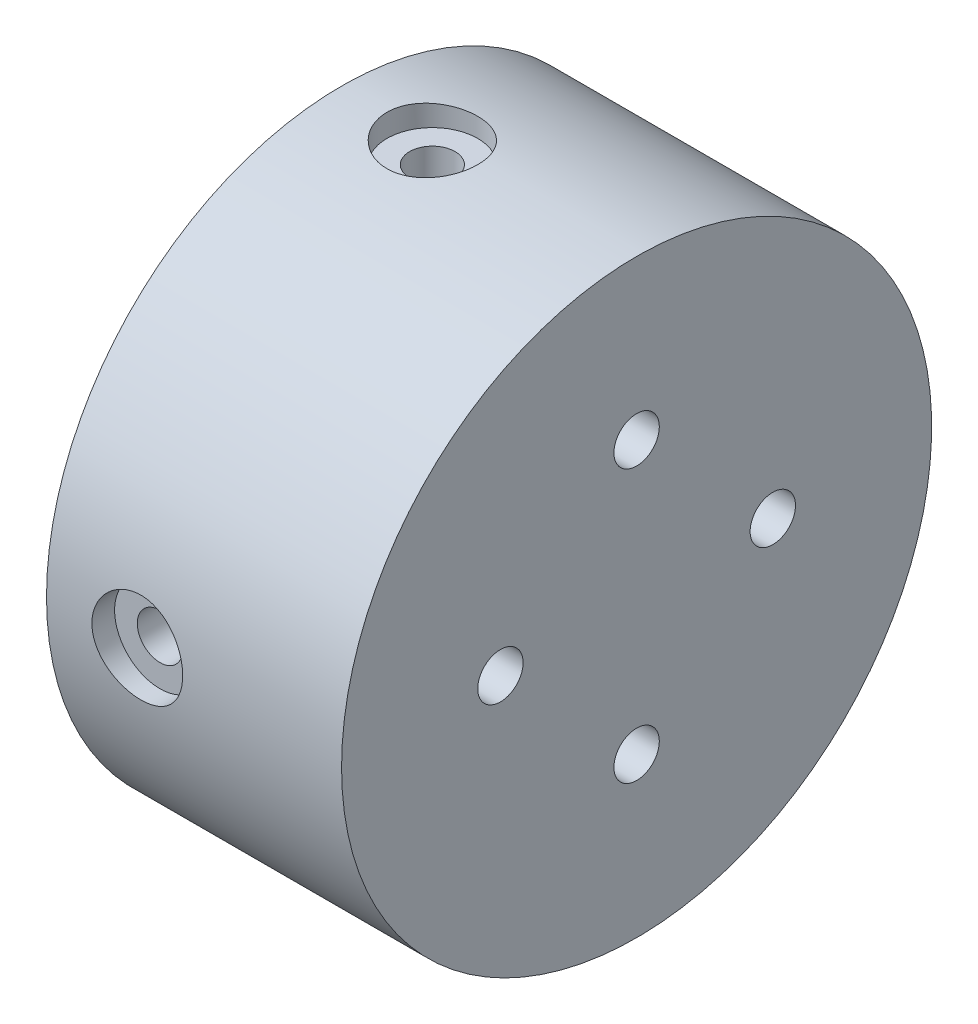
from build123d import *

# Parameters (mm, degrees)
CUT_EXTRUDE_1_REACH      = 24.517
SKETCH_2_R               = 1
PATTERN_CIRCULAR_1_COUNT = 4
SKETCH_5_R               = 1
CUT_EXTRUDE_2_DEPTH      = 10
PATTERN_CIRCULAR_3_COUNT = 4
SKETCH_7_R               = 2
CUT_EXTRUDE_3_DEPTH      = 1
PATTERN_CIRCULAR_4_COUNT = 4


with BuildPart() as part:
    # Эскиз1 → Повернуть1 (revolve)
    with BuildSketch(Plane.XY):
        Polygon((0, 13), (13, 13), (13, 0), (10, 0), (10, 10), (0, 10), align=None)
    revolve(axis=Axis((0, 0, 0), (1, 0, 0)))

    # Эскиз2 → Вырез-Вытянуть1 (cut, up to next)
    with BuildSketch(Plane(origin=(13, 0, 0), x_dir=(0, 0, -1), z_dir=(1, 0, 0)), mode=Mode.PRIVATE) as cut_extrude_1_sk1:
        with Locations((0, 6)):
            Circle(SKETCH_2_R)
    cut_extrude_1_tool1 = extrude(cut_extrude_1_sk1.sketch, amount=-CUT_EXTRUDE_1_REACH, mode=Mode.PRIVATE) & part.part
    cut_extrude_1 = cut_extrude_1_tool1.solids().sort_by_distance((13, 6, 0))[0]
    add(cut_extrude_1, mode=Mode.SUBTRACT)

    # Круговой массив1: Вырез-Вытянуть1 ×4 about axis
    pattern_circular_1_axis = Axis((10, 0, 0), (-1, 0, 0))
    for i in range(1, PATTERN_CIRCULAR_1_COUNT):
        add(cut_extrude_1.rotate(pattern_circular_1_axis, i * 360 / PATTERN_CIRCULAR_1_COUNT), mode=Mode.SUBTRACT)

    # Эскиз5 → Вырез-Вытянуть2 (cut)
    with BuildSketch(Plane.XY.offset(13)):
        with Locations((4, 0)):
            Circle(SKETCH_5_R)
    cut_extrude_2 = extrude(amount=-CUT_EXTRUDE_2_DEPTH, mode=Mode.SUBTRACT)

    # Круговой массив3: Вырез-Вытянуть2 ×4 about axis
    pattern_circular_3_axis = Axis((10, 0, 0), (-1, 0, 0))
    for i in range(1, PATTERN_CIRCULAR_3_COUNT):
        add(cut_extrude_2.rotate(pattern_circular_3_axis, i * 360 / PATTERN_CIRCULAR_3_COUNT), mode=Mode.SUBTRACT)

    # Эскиз7 → Вырез-Вытянуть3 (cut)
    with BuildSketch(Plane.XY.offset(13)):
        with Locations((4, 0)):
            Circle(SKETCH_7_R)
    cut_extrude_3 = extrude(amount=-CUT_EXTRUDE_3_DEPTH, mode=Mode.SUBTRACT)

    # Круговой массив4: Вырез-Вытянуть3 ×4 about axis
    pattern_circular_4_axis = Axis((10, 0, 0), (-1, 0, 0))
    for i in range(1, PATTERN_CIRCULAR_4_COUNT):
        add(cut_extrude_3.rotate(pattern_circular_4_axis, i * 360 / PATTERN_CIRCULAR_4_COUNT), mode=Mode.SUBTRACT)


solid = part.part
